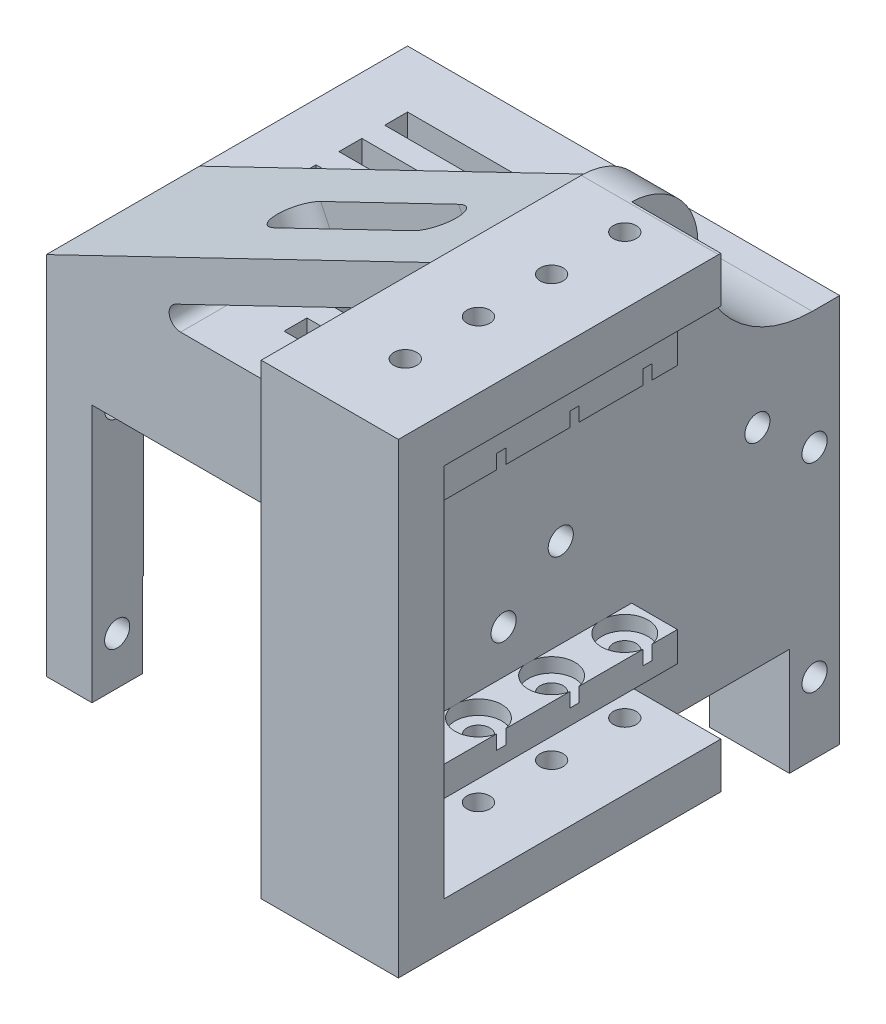
from build123d import *

# Parameters (mm, degrees)
SKETCH1_W               = 57.912
SKETCH1_H               = 63.754
BOSS_EXTRUDE1_DEPTH     = 58.928
SKETCH3_W               = 34.036
SKETCH3_H               = 31.242
SKETCH3_W_2             = 9.906
SKETCH3_H_2             = 11.938
CUT_EXTRUDE1_DEPTH      = 105.359385989
SKETCH4_R               = 1.27
SKETCH4_W               = 42.672
SKETCH4_H               = 18.796
SKETCH4_W_2             = 9.906
SKETCH4_H_2             = 23.114
CUT_EXTRUDE2_DEPTH      = 105.359385989
FILLET1_R               = 2.54
CUT_EXTRUDE3_DEPTH      = 20.574
FILLET2_R               = 12.7
FILLET3_R               = 7.62
FILLET4_R               = 7.62
CUT_EXTRUDE4_DEPTH      = 4.064
SKETCH8_W               = 27.94
SKETCH8_H               = 2.54
SKETCH8_W_2             = 13.716
CUT_EXTRUDE5_DEPTH      = 94.224574746
SKETCH9_W               = 34.036
SKETCH9_H               = 39.116
CUT_EXTRUDE6_DEPTH      = 5.588
BOSS_EXTRUDE3_DEPTH     = 34.036
FILLET5_R               = 3.048
CUT_EXTRUDE7_DEPTH      = 97.736659463
CUT_EXTRUDE7_DEPTH_BACK = 97.736659463
SKETCH12_W              = 7.874
SKETCH12_H              = 20.574
CUT_EXTRUDE8_START      = -42.672
SKETCH14_W              = 28.811262335
SKETCH14_H              = 20.32
CUT_EXTRUDE8_DEPTH      = 42.672
SKETCH17_R              = 1.397
CUT_EXTRUDE9_DEPTH      = 105.359385989
CUT_EXTRUDE10_DEPTH     = 30.734
SKETCH19_R              = 2.5908
CUT_EXTRUDE13_DEPTH     = 1.5875
CUT_EXTRUDE14_START     = -1.5875
SKETCH20_R              = 2.5908
CUT_EXTRUDE14_DEPTH     = 1.5875


with BuildPart() as part:
    # Sketch1 → Boss-Extrude1 (new body)
    with BuildSketch(Plane.XY):
        with Locations((28.956, 31.877)):
            Rectangle(SKETCH1_W, SKETCH1_H)
    extrude(amount=-BOSS_EXTRUDE1_DEPTH)

    # Sketch3 → Cut-Extrude1 (cut, through all)
    with BuildSketch(Plane.XY):
        Polygon((42.672, 63.754), (0, 43.18), (0, 63.754), align=None)
        with BuildLine():
            Line((42.672, 59.242297846), (14.364369972, 45.593976225))
            ThreePointArc((14.364369972, 45.593976225), (13.677836685, 44.167112926), (14.915929938, 43.18))
            Line((14.915929938, 43.18), (42.672, 43.18))
            Line((42.672, 43.18), (42.672, 59.242297846))
        make_face()
        with Locations((22.098, 15.621)):
            Rectangle(SKETCH3_W, SKETCH3_H)
        with Locations((52.959, 5.969)):
            Rectangle(SKETCH3_W_2, SKETCH3_H_2)
    extrude(amount=-CUT_EXTRUDE1_DEPTH, mode=Mode.SUBTRACT)

    # Sketch4 → Cut-Extrude2 (cut, through all)
    with BuildSketch(Plane(origin=(0, 63.754, 0), x_dir=(1, 0, 0), z_dir=(0, 1, 0))):
        with Locations(Location((50.546, 32.512, 0), (0, 0, 270))):
            Circle(SKETCH4_R)
        with Locations(Location((50.546, 24.384, 0), (0, 0, 270))):
            Circle(SKETCH4_R)
        with Locations(Location((50.546, 16.256, 0), (0, 0, 270))):
            Circle(SKETCH4_R)
        with Locations(Location((50.546, 8.128, 0), (0, 0, 270))):
            Circle(SKETCH4_R)
        with Locations((21.336, 9.398)):
            Rectangle(SKETCH4_W, SKETCH4_H)
        with Locations((52.959, 47.371)):
            Rectangle(SKETCH4_W_2, SKETCH4_H_2)
    extrude(amount=-CUT_EXTRUDE2_DEPTH, mode=Mode.SUBTRACT)

    # Fillet1
    fillet1_edges = [part.edges().sort_by_distance(p)[0] for p in [
        (42.672, 21.59, -18.796),
    ]]
    fillet(fillet1_edges, radius=FILLET1_R)

    # Sketch6 → Cut-Extrude3 (cut)
    with BuildSketch(Plane(origin=(0, 63.754, 0), x_dir=(1, 0, 0), z_dir=(0, 1, 0))):
        Polygon((42.672, 35.814), (0, 35.814), (0, 58.928), (48.006, 58.928), (48.006, 43.18), (42.672, 43.18), align=None)
    extrude(amount=-CUT_EXTRUDE3_DEPTH, mode=Mode.SUBTRACT)

    # Fillet2
    fillet2_edges = [part.edges().sort_by_distance(p)[0] for p in [
        (45.339, 43.18, -43.18),
    ]]
    fillet(fillet2_edges, radius=FILLET2_R)

    # Fillet3
    fillet3_edges = [part.edges().sort_by_distance(p)[0] for p in [
        (42.672, 43.18, -36.068),
    ]]
    fillet(fillet3_edges, radius=FILLET3_R)

    # Fillet4
    # the kernel refuses this fillet: 7.62 mm, written as the material it takes off along each edge
    with BuildSketch(Plane(origin=(67.056, 63.754, -43.18), x_dir=(0, 0, 1), z_dir=(-1, 0, 0))) as fillet4_piece_1:
        with BuildLine():
            CenterArc((FILLET4_R, -FILLET4_R), FILLET4_R, 90, 90)
            Line((0, -FILLET4_R), (0, 0))
            Line((0, 0), (FILLET4_R, 0))
        make_face()
    extrude(amount=43.434, mode=Mode.SUBTRACT)

    # Sketch7 → Cut-Extrude4 (cut)
    with BuildSketch(Plane(origin=(-16.892150065, 35.035570505, 0), x_dir=(0.9007686813688952, 0.43429918566000303, 0), z_dir=(-0.43429918566000303, 0.9007686813688952, 0))):
        with BuildLine():
            Line((57.489911454, 24.638), (40.471911454, 24.638))
            ThreePointArc((40.471911454, 24.638), (37.931911454, 27.178), (40.471911454, 29.718))
            Line((40.471911454, 29.718), (57.489911454, 29.718))
            ThreePointArc((57.489911454, 29.718), (60.029911454, 27.178), (57.489911454, 24.638))
        make_face()
    extrude(amount=-CUT_EXTRUDE4_DEPTH, mode=Mode.SUBTRACT)

    # Sketch8 → Cut-Extrude5 (cut, through all)
    with BuildSketch(Plane(origin=(0, 43.18, 0), x_dir=(1, 0, 0), z_dir=(0, 1, 0))):
        with Locations((20.32, 51.308)):
            Rectangle(SKETCH8_W, SKETCH8_H)
        with Locations((20.32, 46.228)):
            Rectangle(SKETCH8_W, SKETCH8_H)
        with Locations((20.32, 41.148)):
            Rectangle(SKETCH8_W, SKETCH8_H)
        with Locations((27.432, 36.068)):
            Rectangle(SKETCH8_W_2, SKETCH8_H)
        with Locations((27.432, 30.988)):
            Rectangle(SKETCH8_W_2, SKETCH8_H)
        with Locations((27.432, 25.908)):
            Rectangle(SKETCH8_W_2, SKETCH8_H)
    extrude(amount=-CUT_EXTRUDE5_DEPTH, mode=Mode.SUBTRACT)

    # Sketch9 → Cut-Extrude6 (cut)
    with BuildSketch(Plane.XZ.offset(-31.242)):
        with Locations((22.098, -38.862)):
            Rectangle(SKETCH9_W, SKETCH9_H)
    extrude(amount=-CUT_EXTRUDE6_DEPTH, mode=Mode.SUBTRACT)

    # Sketch10 → Boss-Extrude3 (add)
    with BuildSketch(Plane(origin=(5.08, 0, 0), x_dir=(0, 0, -1), z_dir=(1, 0, 0))):
        Polygon((58.42, 31.242), (54.619546979, 36.83), (58.42, 36.83), align=None)
    boss_extrude3 = extrude(amount=BOSS_EXTRUDE3_DEPTH)

    # Mirror1: Boss-Extrude3 across plane
    add(boss_extrude3.mirror(Plane.XY.offset(-38.862)))

    # Fillet5
    # the kernel refuses this fillet: 3.048 mm, written as the material it adds along each edge
    with BuildSketch(Plane(origin=(1.047120303, 36.83, -54.619546979), x_dir=(0, -0.8268843197776327, -0.5623720491861963), z_dir=(1, 0, 0))) as fillet5_piece_1:
        with BuildLine():
            CenterArc((FILLET5_R * 0.5292493041, -FILLET5_R), FILLET5_R, 90, 55.78)
            Line((-FILLET5_R * 0.297635015677, -FILLET5_R * 0.437627950814), (0, 0))
            Line((0, 0), (FILLET5_R * 0.5292493041, 0))
        make_face()
    extrude(amount=42.101759394)
    with BuildSketch(Plane(origin=(1.047120303, 36.83, -23.104453021), x_dir=(0, 0, -1), z_dir=(1, 0, 0))) as fillet5_piece_2_section:
        with BuildLine():
            CenterArc((FILLET5_R * 0.5292493041, -FILLET5_R), FILLET5_R, 90, 55.78)
            Line((-FILLET5_R * 0.297635015677, -FILLET5_R * 0.437627950814), (0, 0))
            Line((0, 0), (FILLET5_R * 0.5292493041, 0))
        make_face()
    fillet5_piece_2 = extrude(amount=42.101759394, mode=Mode.PRIVATE)
    fillet5_piece_2 = split(fillet5_piece_2, bisect_by=Plane(origin=(20.574, 36.829688099, -24.657900546), z_dir=(-1, 0, 0)), keep=Keep.TOP, mode=Mode.PRIVATE)
    add(fillet5_piece_2)
    with BuildSketch(Plane(origin=(1.047120303, 36.83, -23.104453021), x_dir=(0, 0, -1), z_dir=(1, 0, 0))) as fillet5_piece_3_section:
        with BuildLine():
            CenterArc((FILLET5_R * 0.5292493041, -FILLET5_R), FILLET5_R, 90, 55.78)
            Line((-FILLET5_R * 0.297635015677, -FILLET5_R * 0.437627950814), (0, 0))
            Line((0, 0), (FILLET5_R * 0.5292493041, 0))
        make_face()
    fillet5_piece_3 = extrude(amount=42.101759394, mode=Mode.PRIVATE)
    fillet5_piece_3 = split(fillet5_piece_3, bisect_by=Plane(origin=(27.432, 36.551953176, -24.638), z_dir=(0, 0, 1)), keep=Keep.TOP, mode=Mode.PRIVATE)
    add(fillet5_piece_3)
    with BuildSketch(Plane(origin=(1.047120303, 36.83, -23.104453021), x_dir=(0, 0, -1), z_dir=(1, 0, 0))) as fillet5_piece_4_section:
        with BuildLine():
            CenterArc((FILLET5_R * 0.5292493041, -FILLET5_R), FILLET5_R, 90, 55.78)
            Line((-FILLET5_R * 0.297635015677, -FILLET5_R * 0.437627950814), (0, 0))
            Line((0, 0), (FILLET5_R * 0.5292493041, 0))
        make_face()
    fillet5_piece_4 = extrude(amount=42.101759394, mode=Mode.PRIVATE)
    fillet5_piece_4 = split(fillet5_piece_4, bisect_by=Plane(origin=(34.29, 36.829688099, -24.657900546), z_dir=(1, 0, 0)), keep=Keep.TOP, mode=Mode.PRIVATE)
    add(fillet5_piece_4)

    # Sketch12 → Cut-Extrude7 (cut, two sides: drawn at the far end of the back side and taken through both)
    with BuildSketch(Plane.ZY.offset(-42.672).offset(-CUT_EXTRUDE7_DEPTH_BACK)):
        with Locations((-9.017, 38.227)):
            Rectangle(SKETCH12_W, SKETCH12_H)
        Polygon((-53.34, 0), (-53.34, 11.938), (-24.384, 11.938), (-24.384, 2.597585734), (-18.796, 2.597585734), (-18.796, 11.938), (0, 11.938), (0, 0), align=None)
    extrude(amount=CUT_EXTRUDE7_DEPTH + CUT_EXTRUDE7_DEPTH_BACK, mode=Mode.SUBTRACT)

    # Sketch14 → Cut-Extrude8 (cut)
    with BuildSketch(Plane.ZY.offset(CUT_EXTRUDE8_START)):
        with Locations((-38.934368832, 22.098)):
            Rectangle(SKETCH14_W, SKETCH14_H)
    extrude(amount=CUT_EXTRUDE8_DEPTH, mode=Mode.SUBTRACT)

    # Sketch17 → Cut-Extrude9 (cut, through all)
    with BuildSketch(Plane.ZY):
        with Locations((-56.134, 7.874)):
            Circle(SKETCH17_R)
        with Locations((-56.134, 29.972)):
            Circle(SKETCH17_R)
        with Locations((-49.784, 35.052)):
            Circle(SKETCH17_R)
        with Locations(Location((-21.59, 7.874, 0), (0, 0, 270))):
            Circle(SKETCH17_R)
        with Locations(Location((-21.59, 29.972, 0), (0, 0, 90))):
            Circle(SKETCH17_R)
        with Locations(Location((-27.94, 35.052, 0), (0, 0, 90))):
            Circle(SKETCH17_R)
    extrude(amount=-CUT_EXTRUDE9_DEPTH, mode=Mode.SUBTRACT)

    # Sketch18 → Cut-Extrude10 (cut)
    with BuildSketch(Plane(origin=(0, 0, -35.814), x_dir=(-1, 0, 0), z_dir=(0, 0, -1))):
        Polygon((-57.912, 58.66976549), (-48.006, 58.66976549), (-48.006, 53.84376549), (-53.086, 53.84376549), (-53.086, 50.54176549), (-48.006, 50.54176549), (-48.006, 25.146), (-53.086, 25.146), (-53.086, 21.844), (-48.006, 21.844), (-48.006, 17.018), (-57.912, 17.018), align=None)
    extrude(amount=-CUT_EXTRUDE10_DEPTH, mode=Mode.SUBTRACT)

    # Sketch19 → Cut-Extrude13 (cut)
    with BuildSketch(Plane(origin=(0, 25.146, 0), x_dir=(1, 0, 0), z_dir=(0, 1, 0))):
        with Locations((50.546, 32.512)):
            Circle(SKETCH19_R)
        with Locations((50.546, 24.384)):
            Circle(SKETCH19_R)
        with Locations((50.546, 16.256)):
            Circle(SKETCH19_R)
        with Locations((50.546, 8.128)):
            Circle(SKETCH19_R)
    extrude(amount=-CUT_EXTRUDE13_DEPTH, mode=Mode.SUBTRACT)

    # Sketch20 → Cut-Extrude14 (cut)
    with BuildSketch(Plane.XZ.offset(-50.54176549).offset(CUT_EXTRUDE14_START)):
        with Locations((50.546, -8.128)):
            Circle(SKETCH20_R)
        with Locations((50.546, -16.256)):
            Circle(SKETCH20_R)
        with Locations((50.546, -24.384)):
            Circle(SKETCH20_R)
        with Locations((50.546, -32.512)):
            Circle(SKETCH20_R)
    extrude(amount=CUT_EXTRUDE14_DEPTH, mode=Mode.SUBTRACT)


solid = part.part
